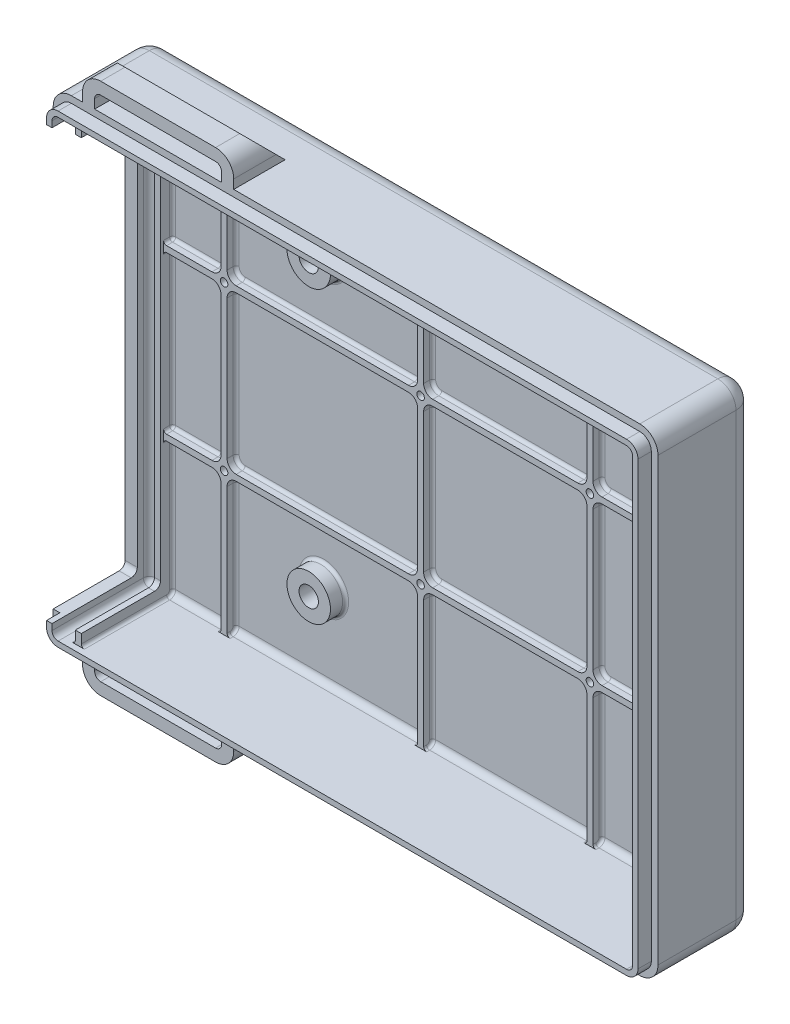
from build123d import *

# Parameters (mm, degrees)
SKETCH_1_W                      = 96
SKETCH_1_H                      = 75
EXTRUDE_1_DEPTH                 = 2
SKETCH_2_W                      = 100
SKETCH_2_H                      = 79
SKETCH_2_W_2                    = 96
SKETCH_2_H_2                    = 75
EXTRUDE_2_DEPTH                 = 18.1
SKETCH_3_W                      = 100
SKETCH_3_H                      = 79
SKETCH_3_W_2                    = 97.8
SKETCH_3_H_2                    = 76.8
CUT_EXTRUDE_1_DEPTH             = 2.2
FILLET_1_R                      = 1
FILLET_2_R                      = 3
FILLET_5_R                      = 1.9
SKETCH_11_W                     = 15.1
SKETCH_11_H                     = 75
EXTRUDE_3_DEPTH                 = 1
SKETCH_9_W                      = 14.1
SKETCH_9_H                      = 71
CUT_EXTRUDE_3_DEPTH             = 126.938913764
CUT_EXTRUDE_3_DIRECTION_2_REACH = 127.939
FILLET_8_R                      = 1
FILLET_9_R                      = 0.5
SKETCH_14_R                     = 3.4
SKETCH_14_R_2                   = 3.6
EXTRUDE_4_DEPTH                 = 2.5
SKETCH_15_R                     = 1.6
CUT_EXTRUDE_4_DEPTH             = 126.371288579
SKETCH_16_R                     = 1.6
CUT_EXTRUDE_5_DEPTH             = 126.371288579
FILLET_10_R                     = 0.5
CHAMFER_2_SIZE                  = 1.5
SKETCH_17_W                     = 31.5
SKETCH_17_H                     = 26
SKETCH_17_W_2                   = 27
EXTRUDE_5_DEPTH                 = 1.5
FILLET_11_R                     = 1.5
SKETCH_18_R                     = 0.625
CUT_EXTRUDE_6_DEPTH             = 1.5
FILLET_12_R                     = 0.5
EXTRUDE_6_DEPTH                 = 4
CHAMFER_3_SIZE                  = 4.5
FILLET_13_R                     = 1
FILLET_14_R                     = 3
SKETCH_20_W                     = 30.5
SKETCH_20_H                     = 50.5
CUT_EXTRUDE_7_DEPTH             = 0.3
SKETCH_21_R                     = 0.75
EXTRUDE_7_DEPTH                 = 0.75
FILLET_15_R                     = 0.75


# Some blends are built 0.0001 mm under size
with BuildPart() as part:
    # 草图1 → 凸台-拉伸1 (new body)
    with BuildSketch(Plane.XY):
        with Locations((48, 37.5)):
            Rectangle(SKETCH_1_W, SKETCH_1_H)
    extrude(amount=EXTRUDE_1_DEPTH)

    # 草图2 → 凸台-拉伸2 (add)
    with BuildSketch(Plane.XY):
        with Locations((48, 37.5)):
            Rectangle(SKETCH_2_W, SKETCH_2_H)
        with Locations((48, 37.5)):
            Rectangle(SKETCH_2_W_2, SKETCH_2_H_2, mode=Mode.SUBTRACT)
    extrude(amount=EXTRUDE_2_DEPTH)

    # 草图3 → 切除-拉伸1 (cut)
    with BuildSketch(Plane.XY.offset(18.1)):
        with Locations((48, 37.5)):
            Rectangle(SKETCH_3_W, SKETCH_3_H)
        with Locations((48, 37.5)):
            Rectangle(SKETCH_3_W_2, SKETCH_3_H_2, mode=Mode.SUBTRACT)
    extrude(amount=-CUT_EXTRUDE_1_DEPTH, mode=Mode.SUBTRACT)

    # 圆角1
    fillet_1_edges = [part.edges().sort_by_distance(p)[0] for p in [
        (96, 37.5, 2),
        (48, 75, 2),
        (0, 0, 10.05),
        (96, 0, 10.05),
        (96, 75, 10.05),
        (0, 75, 10.05),
        (0, 37.5, 2),
        (48, 0, 2),
    ]]
    fillet(fillet_1_edges, radius=FILLET_1_R)

    # 圆角2
    fillet_2_edges = [part.edges().sort_by_distance(p)[0] for p in [
        (-2, 37.5, 0),
        (48, -2, 0),
        (98, 37.5, 0),
        (48, 77, 0),
        (-2, 77, 7.95),
        (98, 77, 7.95),
        (98, -2, 7.95),
        (-2, -2, 7.95),
    ]]
    fillet(fillet_2_edges, radius=FILLET_2_R)

    # 圆角5
    fillet_5_edges = [part.edges().sort_by_distance(p)[0] for p in [
        (-0.9, 75.9, 17),
        (96.9, 75.9, 17),
        (96.9, -0.9, 17),
        (-0.9, -0.9, 17),
    ]]
    fillet(fillet_5_edges, radius=FILLET_5_R)

    # 草图11 → 凸台-拉伸3 (add)
    with BuildSketch(Plane(origin=(2.85, 0, 0), x_dir=(0, 0, -1), z_dir=(1, 0, 0))):
        with Locations((-9.55, 37.5)):
            Rectangle(SKETCH_11_W, SKETCH_11_H)
    extrude(amount=EXTRUDE_3_DEPTH)

    # 草图9 → 切除-拉伸3 (cut)
    with BuildSketch(Plane(origin=(0, 0, 0), x_dir=(0, 0, -1), z_dir=(1, 0, 0))):
        with Locations((-11.05, 37.5)):
            Rectangle(SKETCH_9_W, SKETCH_9_H)
    extrude(amount=-CUT_EXTRUDE_3_DEPTH, mode=Mode.SUBTRACT)

    # 切除-拉伸3 direction 2: up to this face of the body (flat: up to its plane)
    cut_extrude_3_direction_2_end = Plane(part.part.faces().sort_by_distance((3.85, 37.5, 9.552777757))[0])
    # 草图9 → 切除-拉伸3 direction 2 (cut, up to the picked face)
    with BuildSketch(Plane(origin=(0, 0, 0), x_dir=(0, 0, -1), z_dir=(1, 0, 0)), mode=Mode.PRIVATE) as cut_extrude_3_direction_2_sk1:
        with Locations((-11.05, 37.5)):
            Rectangle(SKETCH_9_W, SKETCH_9_H)
    cut_extrude_3_direction_2_tool1 = split(extrude(cut_extrude_3_direction_2_sk1.sketch, amount=CUT_EXTRUDE_3_DIRECTION_2_REACH, mode=Mode.PRIVATE), bisect_by=cut_extrude_3_direction_2_end, keep=Keep.BOTH, mode=Mode.PRIVATE)
    add(cut_extrude_3_direction_2_tool1.solids().sort_by(Axis((0, 37.5, 11.05), (1, 0, 0)))[0], mode=Mode.SUBTRACT)

    # 圆角8
    fillet_8_edges = [part.edges().sort_by_distance(p)[0] for p in [
        (3.35, 73, 4),
        (3.35, 2, 4),
        (-1, 73, 4),
        (-1, 2, 4),
    ]]
    fillet(fillet_8_edges, radius=FILLET_8_R)

    # 圆角9
    fillet_9_edges = [part.edges().sort_by_distance(p)[0] for p in [
        (2.85, 0.292893219, 2.292893219),
        (3.85, 0.292893219, 2.292893219),
        (2.85, 37.5, 2),
        (3.85, 75, 10.05),
        (3.85, 0, 10.05),
        (3.85, 37.5, 2),
        (3.85, 74.707106781, 2.292893219),
        (2.85, 74.707106781, 2.292893219),
        (2.85, 0, 10.05),
        (2.85, 75, 10.05),
    ]]
    fillet(fillet_9_edges, radius=FILLET_9_R)

    # 草图14 → 凸台-拉伸4 (add)
    with BuildSketch(Plane.XY.offset(2)):
        with Locations(Location((90.85, 13.5, 0), (0, 0, 180))):
            Circle(SKETCH_14_R)
        with Locations(Location((90.85, 61.5, 0), (0, 0, 180))):
            Circle(SKETCH_14_R)
        with Locations(Location((28.85, 13.5, 0), (0, 0, 180))):
            Circle(SKETCH_14_R_2)
        with Locations(Location((28.85, 61.5, 0), (0, 0, 180))):
            Circle(SKETCH_14_R_2)
    extrude(amount=EXTRUDE_4_DEPTH)

    # 草图15 → 切除-拉伸4 (cut, through all)
    with BuildSketch(Plane.XY.offset(4.5)):
        with Locations((28.85, 61.5)):
            Circle(SKETCH_15_R)
        with Locations((28.85, 13.5)):
            Circle(SKETCH_15_R)
    extrude(amount=-CUT_EXTRUDE_4_DEPTH, mode=Mode.SUBTRACT)

    # 草图16 → 切除-拉伸5 (cut, through all)
    with BuildSketch(Plane.XY.offset(4.5)):
        with Locations((90.85, 61.5)):
            Circle(SKETCH_16_R)
        with Locations((90.85, 13.5)):
            Circle(SKETCH_16_R)
    extrude(amount=-CUT_EXTRUDE_5_DEPTH, mode=Mode.SUBTRACT)

    # 圆角10
    fillet_10_edges = [part.edges().sort_by_distance(p)[0] for p in [
        (94.25, 13.5, 2),
        (94.25, 61.5, 2),
        (32.45, 61.5, 2),
        (32.45, 13.5, 2),
    ]]
    fillet(fillet_10_edges, radius=FILLET_10_R)

    # 倒角2
    chamfer_2_edges = [part.edges().sort_by_distance(p)[0] for p in [
        (27.25, 61.5, 0),
        (27.25, 13.5, 0),
        (89.25, 61.5, 0),
        (89.25, 13.5, 0),
    ]]
    chamfer(chamfer_2_edges, length=CHAMFER_2_SIZE)

    # 草图17 → 凸台-拉伸5 (add)
    with BuildSketch(Plane.XY.offset(2)):
        Polygon((3.85, 51), (13.35, 51), (13.35, 75), (14.35, 75), (14.35, 51), (45.85, 51), (45.85, 75), (46.85, 75), (46.85, 51), (73.85, 51), (73.85, 75), (74.85, 75), (74.85, 51), (96, 51), (96, 50), (74.85, 50), (74.85, 24), (96, 24), (96, 23), (74.85, 23), (74.85, 0), (73.85, 0), (73.85, 23), (46.85, 23), (46.85, 0), (45.85, 0), (45.85, 23), (14.35, 23), (14.35, 0), (13.35, 0), (13.35, 23), (3.85, 23), (3.85, 24), (13.35, 24), (13.35, 50), (3.85, 50), align=None)
        with Locations((30.1, 37)):
            Rectangle(SKETCH_17_W, SKETCH_17_H, mode=Mode.SUBTRACT)
        with Locations((60.35, 37)):
            Rectangle(SKETCH_17_W_2, SKETCH_17_H, mode=Mode.SUBTRACT)
    extrude(amount=EXTRUDE_5_DEPTH)

    # 圆角11
    fillet_11_edges = [part.edges().sort_by_distance(p)[0] for p in [
        (74.85, 51, 2.75),
        (46.85, 51, 2.75),
        (14.35, 51, 2.75),
        (74.85, 23, 2.75),
        (74.85, 50, 2.75),
        (13.35, 23, 2.75),
        (45.85, 23, 2.75),
        (73.85, 23, 2.75),
        (13.35, 24, 2.75),
        (13.35, 51, 2.75),
        (13.35, 50, 2.75),
        (14.35, 23, 2.75),
        (46.85, 23, 2.75),
        (74.85, 24, 2.75),
        (73.85, 51, 2.75),
        (45.85, 51, 2.75),
        (14.35, 24, 2.75),
        (45.85, 24, 2.75),
        (45.85, 50, 2.75),
        (14.35, 50, 2.75),
        (46.85, 24, 2.75),
        (73.85, 24, 2.75),
        (73.85, 50, 2.75),
        (46.85, 50, 2.75),
    ]]
    fillet(fillet_11_edges, radius=FILLET_11_R)

    # 草图18 → 切除-拉伸6 (cut)
    with BuildSketch(Plane.XY.offset(3.5)):
        with Locations((13.85, 50.5)):
            Circle(SKETCH_18_R)
        with Locations((46.35, 50.5)):
            Circle(SKETCH_18_R)
        with Locations((74.35, 50.5)):
            Circle(SKETCH_18_R)
        with Locations((74.35, 23.5)):
            Circle(SKETCH_18_R)
        with Locations((46.35, 23.5)):
            Circle(SKETCH_18_R)
        with Locations((13.85, 23.5)):
            Circle(SKETCH_18_R)
    extrude(amount=-CUT_EXTRUDE_6_DEPTH, mode=Mode.SUBTRACT)

    # 圆角12
    fillet_12_edges = [part.edges().sort_by_distance(p)[0] for p in [
        (3.996446609, 51, 2.146446609),
        (3.996446609, 23, 2.146446609),
        (3.996446609, 24, 2.146446609),
        (3.996446609, 50, 2.146446609),
        (74.85, 0.292893219, 2.292893219),
        (73.85, 0.292893219, 2.292893219),
        (46.85, 0.292893219, 2.292893219),
        (45.85, 0.292893219, 2.292893219),
        (14.35, 0.292893219, 2.292893219),
        (13.35, 0.292893219, 2.292893219),
        (95.707106781, 51, 2.292893219),
        (95.707106781, 50, 2.292893219),
        (95.707106781, 24, 2.292893219),
        (95.707106781, 23, 2.292893219),
        (13.35, 74.707106781, 2.292893219),
        (14.35, 74.707106781, 2.292893219),
        (45.85, 74.707106781, 2.292893219),
        (46.85, 74.707106781, 2.292893219),
        (73.85, 74.707106781, 2.292893219),
        (74.85, 74.707106781, 2.292893219),
        (73.85, 75, 3.25),
        (73.85, 63.25, 2),
        (45.85, 75, 3.25),
        (45.85, 63.25, 2),
        (13.35, 75, 3.25),
        (13.35, 63.25, 2),
        (96, 24, 3.25),
        (85.675, 24, 2),
        (96, 51, 3.25),
        (85.675, 51, 2),
        (14.35, 0, 3.25),
        (14.35, 11.25, 2),
        (46.85, 0, 3.25),
        (46.85, 11.25, 2),
        (74.85, 0, 3.25),
        (74.85, 11.25, 2),
        (3.85, 51, 3),
        (3.85, 50, 3),
        (8.1, 50, 2),
        (3.85, 24, 3),
        (3.85, 23, 3),
        (8.1, 23, 2),
        (13.35, 0, 3.25),
        (45.85, 0, 3.25),
        (73.85, 0, 3.25),
        (96, 23, 3.25),
        (96, 50, 3.25),
        (74.85, 75, 3.25),
        (46.85, 75, 3.25),
        (14.35, 75, 3.25),
        (85.675, 23, 2),
        (75.289339828, 22.560660172, 2),
        (73.85, 11.25, 2),
        (60.35, 23, 2),
        (47.289339828, 22.560660172, 2),
        (73.410660172, 22.560660172, 2),
        (45.85, 11.25, 2),
        (30.1, 23, 2),
        (14.789339828, 22.560660172, 2),
        (45.410660172, 22.560660172, 2),
        (13.35, 11.25, 2),
        (12.910660172, 22.560660172, 2),
        (8.1, 51, 2),
        (12.910660172, 51.439339828, 2),
        (60.35, 51, 2),
        (46.85, 63.25, 2),
        (47.289339828, 51.439339828, 2),
        (73.410660172, 51.439339828, 2),
        (74.85, 63.25, 2),
        (75.289339828, 51.439339828, 2),
        (30.1, 51, 2),
        (14.35, 63.25, 2),
        (14.789339828, 51.439339828, 2),
        (45.410660172, 51.439339828, 2),
        (8.1, 24, 2),
        (13.35, 37, 2),
        (12.910660172, 49.560660172, 2),
        (12.910660172, 24.439339828, 2),
        (74.85, 37, 2),
        (85.675, 50, 2),
        (75.289339828, 49.560660172, 2),
        (75.289339828, 24.439339828, 2),
        (60.35, 24, 2),
        (60.35, 50, 2),
        (46.85, 37, 2),
        (73.85, 37, 2),
        (47.289339828, 49.560660172, 2),
        (47.289339828, 24.439339828, 2),
        (73.410660172, 49.560660172, 2),
        (73.410660172, 24.439339828, 2),
        (30.1, 24, 2),
        (30.1, 50, 2),
        (14.35, 37, 2),
        (45.85, 37, 2),
        (14.789339828, 49.560660172, 2),
        (14.789339828, 24.439339828, 2),
        (45.410660172, 49.560660172, 2),
        (45.410660172, 24.439339828, 2),
        (13.225, 23.5, 2),
        (45.725, 23.5, 2),
        (73.725, 23.5, 2),
        (73.725, 50.5, 2),
        (45.725, 50.5, 2),
        (13.225, 50.5, 2),
    ]]
    fillet(fillet_12_edges, radius=FILLET_12_R)

    # 草图19 → 凸台-拉伸6 (add)
    with BuildSketch(Plane.XY.offset(15.9)):
        Polygon((2.85, 77), (4.85, 77), (4.85, 79.5), (25.85, 79.5), (25.85, 77), (27.85, 77), (27.85, 81.5), (2.85, 81.5), align=None)
    extrude_6 = extrude(amount=-EXTRUDE_6_DEPTH)

    # 镜向1: 凸台-拉伸6 across plane
    add(extrude_6.mirror(Plane(origin=(0, 37.5, 0), x_dir=(0, 0, 1), z_dir=(0, -1, 0))))

    # 倒角3
    # the kernel refuses this chamfer: 4.5 mm, written as the material it adds along each edge
    with BuildSketch(Plane(origin=(14.277426554, 77, 11.9), x_dir=(0, -0.027495876610585245, -0.9996219169112969), z_dir=(1, 0, 0))) as chamfer_3_piece_1_section:
        Polygon((CHAMFER_3_SIZE * 0.999621916911, CHAMFER_3_SIZE * 0.0274958766106), (-CHAMFER_3_SIZE * 0.0274958766106, CHAMFER_3_SIZE * 0.999621916911), (0, 0), align=None)
    chamfer_3_piece_1 = extrude(amount=13.572573446, mode=Mode.PRIVATE)
    chamfer_3_piece_1 = split(chamfer_3_piece_1, bisect_by=Plane(origin=(25.85, 80.224685919, 11.326327073), z_dir=(-1, 0, 0)), keep=Keep.TOP, mode=Mode.PRIVATE)
    chamfer_3_piece_1 = split(chamfer_3_piece_1, bisect_by=Plane(origin=(20.063713277, 81.5, 11.326327073), z_dir=(0, -1, 0)), keep=Keep.TOP, mode=Mode.PRIVATE)
    chamfer_3_piece_1 = split(chamfer_3_piece_1, bisect_by=Plane(origin=(20.063713277, 79.5, 11.326327073), z_dir=(0, 1, 0)), keep=Keep.TOP, mode=Mode.PRIVATE)
    add(chamfer_3_piece_1)
    with BuildSketch(Plane(origin=(25.85, 77, 11.9), x_dir=(0, -0.027495876610585245, -0.9996219169112969), z_dir=(1, 0, 0))) as chamfer_3_piece_2_section:
        Polygon((CHAMFER_3_SIZE * 0.999621916911, CHAMFER_3_SIZE * 0.0274958766106), (-CHAMFER_3_SIZE * 0.0274958766106, CHAMFER_3_SIZE * 0.999621916911), (0, 0), align=None)
    chamfer_3_piece_2 = extrude(amount=2, mode=Mode.PRIVATE)
    chamfer_3_piece_2 = split(chamfer_3_piece_2, bisect_by=Plane(origin=(26.85, 79.5, 10.176891087), z_dir=(0, -1, 0)), keep=Keep.TOP, mode=Mode.PRIVATE)
    add(chamfer_3_piece_2)
    with BuildSketch(Plane(origin=(25.85, 77, 11.9), x_dir=(0, -0.027495876610585245, -0.9996219169112969), z_dir=(1, 0, 0))) as chamfer_3_piece_3_section:
        Polygon((CHAMFER_3_SIZE * 0.999621916911, CHAMFER_3_SIZE * 0.0274958766106), (-CHAMFER_3_SIZE * 0.0274958766106, CHAMFER_3_SIZE * 0.999621916911), (0, 0), align=None)
    chamfer_3_piece_3 = extrude(amount=2, mode=Mode.PRIVATE)
    chamfer_3_piece_3 = split(chamfer_3_piece_3, bisect_by=Plane(origin=(26.85, 81.5, 11.326327073), z_dir=(0, -1, 0)), keep=Keep.TOP, mode=Mode.PRIVATE)
    chamfer_3_piece_3 = split(chamfer_3_piece_3, bisect_by=Plane(origin=(26.85, 79.5, 11.326327073), z_dir=(0, 1, 0)), keep=Keep.TOP, mode=Mode.PRIVATE)
    add(chamfer_3_piece_3)
    with BuildSketch(Plane(origin=(2.85, 77, 11.9), x_dir=(0, -0.027495876610585245, -0.9996219169112969), z_dir=(1, 0, 0))) as chamfer_3_piece_4_section:
        Polygon((CHAMFER_3_SIZE * 0.999621916911, CHAMFER_3_SIZE * 0.0274958766106), (-CHAMFER_3_SIZE * 0.0274958766106, CHAMFER_3_SIZE * 0.999621916911), (0, 0), align=None)
    chamfer_3_piece_4 = extrude(amount=2, mode=Mode.PRIVATE)
    chamfer_3_piece_4 = split(chamfer_3_piece_4, bisect_by=Plane(origin=(3.85, 79.5, 10.176891087), z_dir=(0, -1, 0)), keep=Keep.TOP, mode=Mode.PRIVATE)
    add(chamfer_3_piece_4)
    with BuildSketch(Plane(origin=(2.85, 77, 11.9), x_dir=(0, -0.027495876610585245, -0.9996219169112969), z_dir=(1, 0, 0))) as chamfer_3_piece_5_section:
        Polygon((CHAMFER_3_SIZE * 0.999621916911, CHAMFER_3_SIZE * 0.0274958766106), (-CHAMFER_3_SIZE * 0.0274958766106, CHAMFER_3_SIZE * 0.999621916911), (0, 0), align=None)
    chamfer_3_piece_5 = extrude(amount=2, mode=Mode.PRIVATE)
    chamfer_3_piece_5 = split(chamfer_3_piece_5, bisect_by=Plane(origin=(3.85, 81.5, 11.326327073), z_dir=(0, -1, 0)), keep=Keep.TOP, mode=Mode.PRIVATE)
    chamfer_3_piece_5 = split(chamfer_3_piece_5, bisect_by=Plane(origin=(3.85, 79.5, 11.326327073), z_dir=(0, 1, 0)), keep=Keep.TOP, mode=Mode.PRIVATE)
    add(chamfer_3_piece_5)
    with BuildSketch(Plane(origin=(2.85, 77, 11.9), x_dir=(0, -0.027495876610585245, -0.9996219169112969), z_dir=(1, 0, 0))) as chamfer_3_piece_6_section:
        Polygon((CHAMFER_3_SIZE * 0.999621916911, CHAMFER_3_SIZE * 0.0274958766106), (-CHAMFER_3_SIZE * 0.0274958766106, CHAMFER_3_SIZE * 0.999621916911), (0, 0), align=None)
    chamfer_3_piece_6 = extrude(amount=13.572573446, mode=Mode.PRIVATE)
    chamfer_3_piece_6 = split(chamfer_3_piece_6, bisect_by=Plane(origin=(4.85, 80.224685919, 11.326327073), z_dir=(1, 0, 0)), keep=Keep.TOP, mode=Mode.PRIVATE)
    chamfer_3_piece_6 = split(chamfer_3_piece_6, bisect_by=Plane(origin=(10.636286723, 81.5, 11.326327073), z_dir=(0, -1, 0)), keep=Keep.TOP, mode=Mode.PRIVATE)
    chamfer_3_piece_6 = split(chamfer_3_piece_6, bisect_by=Plane(origin=(10.636286723, 79.5, 11.326327073), z_dir=(0, 1, 0)), keep=Keep.TOP, mode=Mode.PRIVATE)
    add(chamfer_3_piece_6)
    with BuildSketch(Plane(origin=(2.85, -2, 11.9), x_dir=(0, 0.02749587661058639, -0.9996219169112966), z_dir=(1, 0, 0))) as chamfer_3_piece_7_section:
        Polygon((CHAMFER_3_SIZE * 0.999621916911, -CHAMFER_3_SIZE * 0.0274958766106), (-CHAMFER_3_SIZE * 0.0274958766106, -CHAMFER_3_SIZE * 0.999621916911), (0, 0), align=None)
    chamfer_3_piece_7 = extrude(amount=2, mode=Mode.PRIVATE)
    chamfer_3_piece_7 = split(chamfer_3_piece_7, bisect_by=Plane(origin=(3.85, -4.5, 10.176891087), z_dir=(0, 1, 0)), keep=Keep.TOP, mode=Mode.PRIVATE)
    add(chamfer_3_piece_7)
    with BuildSketch(Plane(origin=(2.85, -2, 11.9), x_dir=(0, 0.02749587661058639, -0.9996219169112966), z_dir=(1, 0, 0))) as chamfer_3_piece_8_section:
        Polygon((CHAMFER_3_SIZE * 0.999621916911, -CHAMFER_3_SIZE * 0.0274958766106), (-CHAMFER_3_SIZE * 0.0274958766106, -CHAMFER_3_SIZE * 0.999621916911), (0, 0), align=None)
    chamfer_3_piece_8 = extrude(amount=2, mode=Mode.PRIVATE)
    chamfer_3_piece_8 = split(chamfer_3_piece_8, bisect_by=Plane(origin=(3.85, -4.5, 11.326327073), z_dir=(0, -1, 0)), keep=Keep.TOP, mode=Mode.PRIVATE)
    chamfer_3_piece_8 = split(chamfer_3_piece_8, bisect_by=Plane(origin=(3.85, -6.5, 11.326327073), z_dir=(0, 1, 0)), keep=Keep.TOP, mode=Mode.PRIVATE)
    add(chamfer_3_piece_8)
    with BuildSketch(Plane(origin=(2.85, -2, 11.9), x_dir=(0, 0.02749587661058639, -0.9996219169112966), z_dir=(1, 0, 0))) as chamfer_3_piece_9_section:
        Polygon((CHAMFER_3_SIZE * 0.999621916911, -CHAMFER_3_SIZE * 0.0274958766106), (-CHAMFER_3_SIZE * 0.0274958766106, -CHAMFER_3_SIZE * 0.999621916911), (0, 0), align=None)
    chamfer_3_piece_9 = extrude(amount=13.572573446, mode=Mode.PRIVATE)
    chamfer_3_piece_9 = split(chamfer_3_piece_9, bisect_by=Plane(origin=(4.85, -5.224685919, 11.326327073), z_dir=(1, 0, 0)), keep=Keep.TOP, mode=Mode.PRIVATE)
    chamfer_3_piece_9 = split(chamfer_3_piece_9, bisect_by=Plane(origin=(10.636286723, -4.5, 11.326327073), z_dir=(0, -1, 0)), keep=Keep.TOP, mode=Mode.PRIVATE)
    chamfer_3_piece_9 = split(chamfer_3_piece_9, bisect_by=Plane(origin=(10.636286723, -6.5, 11.326327073), z_dir=(0, 1, 0)), keep=Keep.TOP, mode=Mode.PRIVATE)
    add(chamfer_3_piece_9)
    with BuildSketch(Plane(origin=(14.277426554, -2, 11.9), x_dir=(0, 0.02749587661058639, -0.9996219169112966), z_dir=(1, 0, 0))) as chamfer_3_piece_10_section:
        Polygon((CHAMFER_3_SIZE * 0.999621916911, -CHAMFER_3_SIZE * 0.0274958766106), (-CHAMFER_3_SIZE * 0.0274958766106, -CHAMFER_3_SIZE * 0.999621916911), (0, 0), align=None)
    chamfer_3_piece_10 = extrude(amount=13.572573446, mode=Mode.PRIVATE)
    chamfer_3_piece_10 = split(chamfer_3_piece_10, bisect_by=Plane(origin=(25.85, -5.224685919, 11.326327073), z_dir=(-1, 0, 0)), keep=Keep.TOP, mode=Mode.PRIVATE)
    chamfer_3_piece_10 = split(chamfer_3_piece_10, bisect_by=Plane(origin=(20.063713277, -4.5, 11.326327073), z_dir=(0, -1, 0)), keep=Keep.TOP, mode=Mode.PRIVATE)
    chamfer_3_piece_10 = split(chamfer_3_piece_10, bisect_by=Plane(origin=(20.063713277, -6.5, 11.326327073), z_dir=(0, 1, 0)), keep=Keep.TOP, mode=Mode.PRIVATE)
    add(chamfer_3_piece_10)
    with BuildSketch(Plane(origin=(25.85, -2, 11.9), x_dir=(0, 0.027495876610586296, -0.9996219169112966), z_dir=(1, 0, 0))) as chamfer_3_piece_11_section:
        Polygon((CHAMFER_3_SIZE * 0.999621916911, -CHAMFER_3_SIZE * 0.0274958766106), (-CHAMFER_3_SIZE * 0.0274958766106, -CHAMFER_3_SIZE * 0.999621916911), (0, 0), align=None)
    chamfer_3_piece_11 = extrude(amount=2, mode=Mode.PRIVATE)
    chamfer_3_piece_11 = split(chamfer_3_piece_11, bisect_by=Plane(origin=(26.85, -4.5, 10.176891087), z_dir=(0, 1, 0)), keep=Keep.TOP, mode=Mode.PRIVATE)
    add(chamfer_3_piece_11)
    with BuildSketch(Plane(origin=(25.85, -2, 11.9), x_dir=(0, 0.027495876610586296, -0.9996219169112966), z_dir=(1, 0, 0))) as chamfer_3_piece_12_section:
        Polygon((CHAMFER_3_SIZE * 0.999621916911, -CHAMFER_3_SIZE * 0.0274958766106), (-CHAMFER_3_SIZE * 0.0274958766106, -CHAMFER_3_SIZE * 0.999621916911), (0, 0), align=None)
    chamfer_3_piece_12 = extrude(amount=2, mode=Mode.PRIVATE)
    chamfer_3_piece_12 = split(chamfer_3_piece_12, bisect_by=Plane(origin=(26.85, -4.5, 11.326327073), z_dir=(0, -1, 0)), keep=Keep.TOP, mode=Mode.PRIVATE)
    chamfer_3_piece_12 = split(chamfer_3_piece_12, bisect_by=Plane(origin=(26.85, -6.5, 11.326327073), z_dir=(0, 1, 0)), keep=Keep.TOP, mode=Mode.PRIVATE)
    add(chamfer_3_piece_12)

    # 圆角13
    fillet_13_edges = [part.edges().sort_by_distance(p)[0] for p in [
        (25.85, 79.5, 12.9),
        (4.85, 79.5, 12.9),
        (4.85, -4.5, 12.9),
        (25.85, -4.5, 12.9),
    ]]
    fillet(fillet_13_edges, radius=FILLET_13_R)

    # 圆角14
    fillet_14_edges = [part.edges().sort_by_distance(p)[0] for p in [
        (2.85, 81.5, 13.9),
        (27.85, 81.5, 13.9),
        (2.85, -6.5, 13.9),
        (27.85, -6.5, 13.9),
    ]]
    fillet(fillet_14_edges, radius=FILLET_14_R)

    # 草图20 → 切除-拉伸7 (cut)
    with BuildSketch(Plane(origin=(0, 0, 0), x_dir=(-1, 0, 0), z_dir=(0, 0, -1))):
        with Locations((-65.741245848, 37.5)):
            Rectangle(SKETCH_20_W, SKETCH_20_H)
    extrude(amount=-CUT_EXTRUDE_7_DEPTH, mode=Mode.SUBTRACT)

    # 草图21 → 凸台-拉伸7 (add)
    with BuildSketch(Plane(origin=(0, 0, 0), x_dir=(-1, 0, 0), z_dir=(0, 0, -1))):
        with Locations((-93.315541106, 71.25545409)):
            Circle(SKETCH_21_R)
        with Locations((-2.684458894, 71.25545409)):
            Circle(SKETCH_21_R)
        with Locations((-93.315541106, 3.74454591)):
            Circle(SKETCH_21_R)
        with Locations((-2.684458894, 3.74454591)):
            Circle(SKETCH_21_R)
    extrude(amount=EXTRUDE_7_DEPTH)

    # 圆角15
    fillet_15_edges = [part.edges().sort_by_distance(p)[0] for p in [
        (94.065541106, 71.25545409, -0.75),
        (3.434458894, 71.25545409, -0.75),
        (94.065541106, 3.74454591, -0.75),
        (3.434458894, 3.74454591, -0.75),
    ]]
    fillet(fillet_15_edges, radius=FILLET_15_R - 0.0001)  # a hair under: the kernel refuses the full size


solid = part.part
